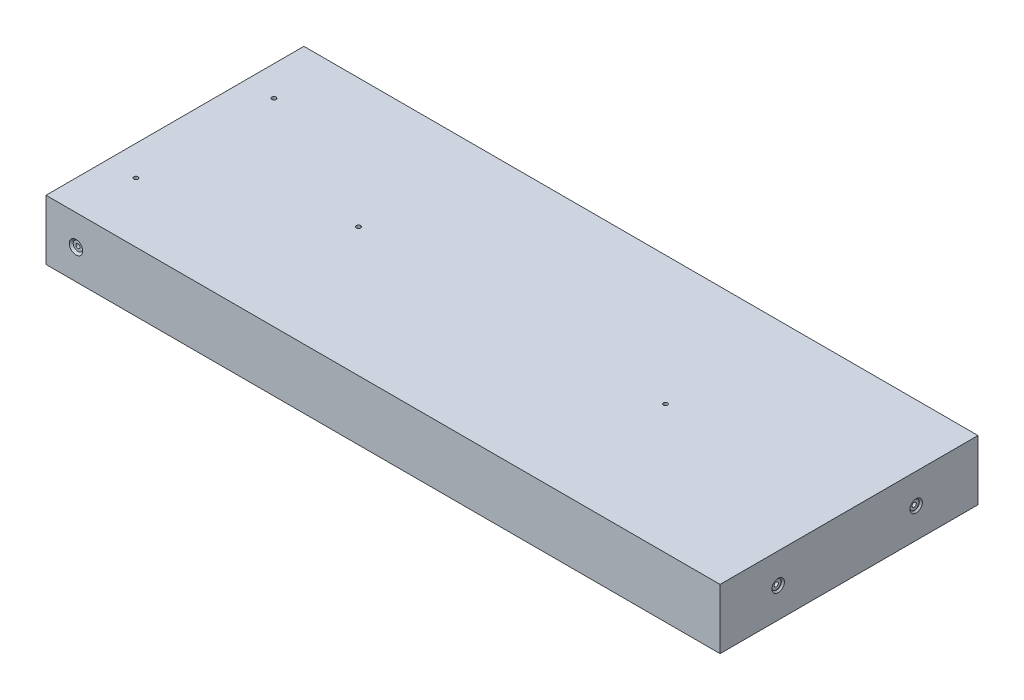
from build123d import *

# Parameters (mm, degrees)
SKETCH1_W                                   = 285.4
SKETCH1_H                                   = 109.2
BOSS_EXTRUDE1_DEPTH                         = 25.4
CBORE_FOR_0_BINDING_HEAD_MACHINE_SC_2_COUNT = 2
CBORE_FOR_0_BINDING_HEAD_MACHINE_SC_2_PITCH = 58.4
CBORE_FOR_0_BINDING_HEAD_MACHINE_SC_3_COUNT = 2
CBORE_FOR_0_BINDING_HEAD_MACHINE_SC_3_PITCH = 130
CBORE_FOR_0_BINDING_HEAD_MACHINE_SC_4_COUNT = 2
CBORE_FOR_0_BINDING_HEAD_MACHINE_SC_4_PITCH = 58.4


with BuildPart() as part:
    # Sketch1 → Boss-Extrude1 (new body)
    with BuildSketch(Plane(origin=(0, 0, 0), x_dir=(1, 0, 0), z_dir=(0, 1, 0))):
        Rectangle(SKETCH1_W, SKETCH1_H)
    extrude(amount=BOSS_EXTRUDE1_DEPTH)

    # Sketch3 → CBORE for #0 Binding Head Machine Screw1 (revolve, cut)
    with BuildSketch(Plane(origin=(-130, 12.7, 54.6), x_dir=(0, -1, 0), z_dir=(1, 0, 0))):
        Polygon((0, 0), (0, 30.53416509), (0.889, 30), (0.889, 0.8128), (1.98501, 0.8128), (1.98501, 0.87249), (2.8575, 0), align=None)
    cbore_for_0_binding_head_machine_screw1 = revolve(axis=Axis((-130, 12.7, 60.95), (0, 0, -1)), mode=Mode.SUBTRACT)

    # Mirror1: CBORE for #0 Binding Head Machine Screw1 across plane
    add(cbore_for_0_binding_head_machine_screw1.mirror(Plane.XY), mode=Mode.SUBTRACT)

    # Sketch5 → CBORE for #0 Binding Head Machine Screw2 (revolve, cut)
    with BuildSketch(Plane(origin=(142.7, 12.7, 30), x_dir=(0, 0, -1), z_dir=(0, 1, 0))):
        Polygon((0, 0), (0, 30.53416509), (0.889, 30), (0.889, 0.8128), (1.98501, 0.8128), (1.98501, 0.635), (2.62001, 0), align=None)
    cbore_for_0_binding_head_machine_screw2 = revolve(axis=Axis((149.05, 12.7, 30), (-1, 0, 0)), mode=Mode.SUBTRACT)

    # CBORE for _0 Binding Head Machine Sc 2: CBORE for #0 Binding Head Machine Screw2 ×2
    with Locations(*[(0, 0, -i * CBORE_FOR_0_BINDING_HEAD_MACHINE_SC_2_PITCH) for i in range(1, CBORE_FOR_0_BINDING_HEAD_MACHINE_SC_2_COUNT)]):
        add(cbore_for_0_binding_head_machine_screw2, mode=Mode.SUBTRACT)

    # Sketch9 → CBORE for #0 Binding Head Machine Screw4 (revolve, cut)
    with BuildSketch(Plane(origin=(-65, 0, 0), x_dir=(0, 0, -1), z_dir=(1, 0, 0))):
        Polygon((0, 0), (0, 30.53416509), (0.889, 30), (0.889, 0.8128), (1.98501, 0.8128), (1.98501, 0.87249), (2.8575, 0), align=None)
    cbore_for_0_binding_head_machine_screw4 = revolve(axis=Axis((-65, -6.35, 0), (0, 1, 0)), mode=Mode.SUBTRACT)

    # CBORE for _0 Binding Head Machine Sc 3: CBORE for #0 Binding Head Machine Screw4 ×2
    with Locations(*[(i * CBORE_FOR_0_BINDING_HEAD_MACHINE_SC_3_PITCH, 0, 0) for i in range(1, CBORE_FOR_0_BINDING_HEAD_MACHINE_SC_3_COUNT)]):
        add(cbore_for_0_binding_head_machine_screw4, mode=Mode.SUBTRACT)

    # Sketch13 → CBORE for #0 Binding Head Machine Screw6 (revolve, cut)
    with BuildSketch(Plane(origin=(-130, 0, -29.2), x_dir=(0, 0, -1), z_dir=(1, 0, 0))):
        Polygon((0, 0), (0, 25.4), (0.889, 25.4), (0.889, 0.8128), (1.98501, 0.8128), (1.98501, 0.87249), (2.8575, 0), align=None)
    cbore_for_0_binding_head_machine_screw6 = revolve(axis=Axis((-130, -6.35, -29.2), (0, 1, 0)), mode=Mode.SUBTRACT)

    # CBORE for _0 Binding Head Machine Sc 4: CBORE for #0 Binding Head Machine Screw6 ×2
    with Locations(*[(0, 0, i * CBORE_FOR_0_BINDING_HEAD_MACHINE_SC_4_PITCH) for i in range(1, CBORE_FOR_0_BINDING_HEAD_MACHINE_SC_4_COUNT)]):
        add(cbore_for_0_binding_head_machine_screw6, mode=Mode.SUBTRACT)


solid = part.part
